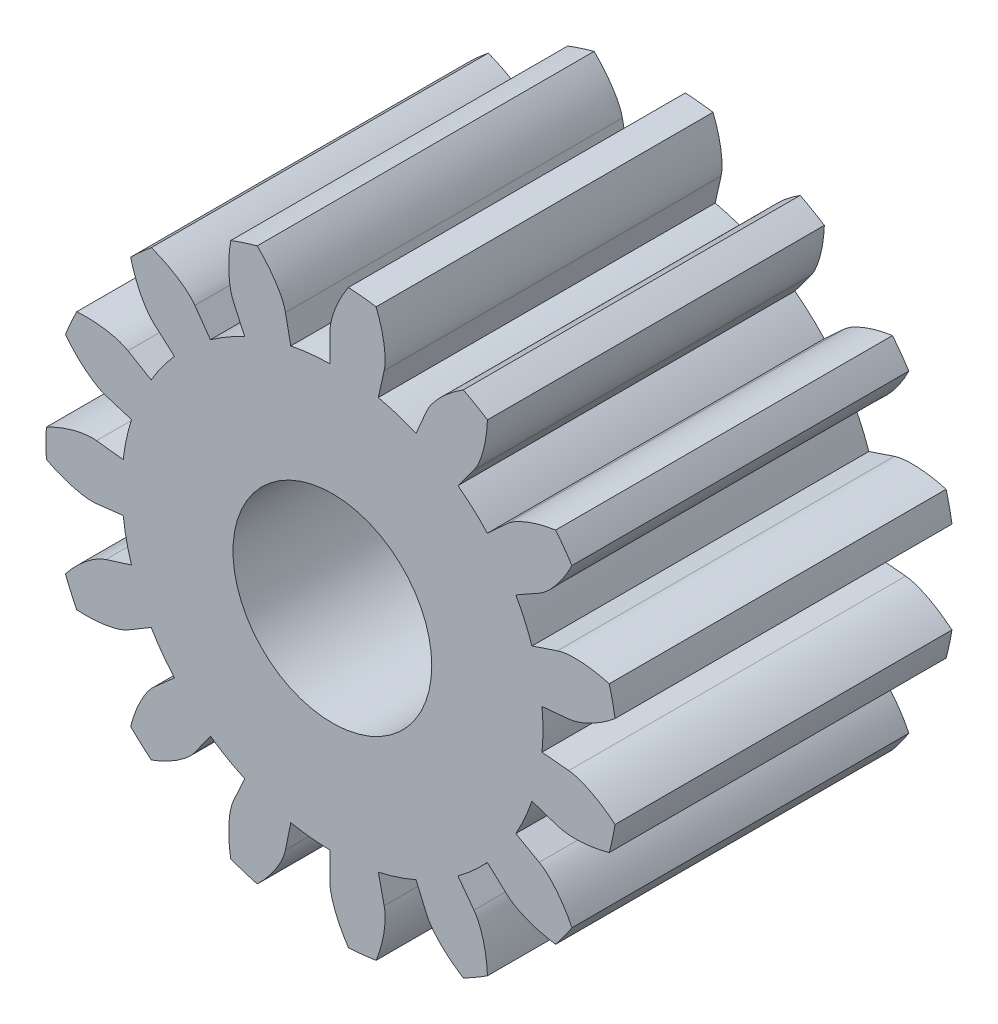
from build123d import *

# Parameters (mm, degrees)
SKETCH_1_R               = 4.25
SKETCH_1_R_2             = 1.475
EXTRUDE_1_DEPTH          = 5
CUT_EXTRUDE_1_DEPTH      = 8.818247886
PATTERN_CIRCULAR_1_COUNT = 15
PATTERN_CIRCULAR_1_ANGLE = 336


with BuildPart() as part:
    # 草图1 → 凸台-拉伸1 (new body)
    with BuildSketch(Plane.XY):
        Circle(SKETCH_1_R)
        Circle(SKETCH_1_R_2, mode=Mode.SUBTRACT)
    extrude(amount=EXTRUDE_1_DEPTH)

    # 草图1<3> → 切除-拉伸1 (cut, through all)
    with BuildSketch(Plane.XY):
        with BuildLine():
            Line((3.508222345, 0.331475445), (3.111143533, 0.293957334))
            ThreePointArc((3.111143533, 0.293957334), (3.121533961, 0.147141867), (3.125, 0))
            ThreePointArc((3.125, 0), (3.121533961, -0.147141867), (3.111143533, -0.293957334))
            Line((3.111143533, -0.293957334), (3.508222345, -0.331475445))
            add(Edge.make_bspline(
                [(3.508222345, -0.331475445), (3.534964575, -0.334002193), (3.609068191, -0.346611518), (3.745685977, -0.392607029), (3.920624729, -0.479806669), (4.060769078, -0.573573304), (4.155340497, -0.647322985), (4.195195075, -0.680322191)],
                knots=[0, 0, 0, 0, 0, 0.005604068, 0.015718248, 0.029959916, 0.040777449, 0.040777449, 0.040777449, 0.040777449, 0.040777449], degree=4))
            ThreePointArc((4.195195075, -0.680322191), (4.236276612, -0.341263045), (4.25, 0))
            ThreePointArc((4.25, 0), (4.236276612, 0.341263045), (4.195195075, 0.680322191))
            add(Edge.make_bspline(
                [(3.508222345, 0.331475445), (3.534964575, 0.334002193), (3.609068191, 0.346611518), (3.745685977, 0.392607029), (3.920624729, 0.479806669), (4.060769078, 0.573573304), (4.155340497, 0.647322985), (4.195195075, 0.680322191)],
                knots=[0, 0, 0, 0, 0, 0.005604068, 0.015718248, 0.029959916, 0.040777449, 0.040777449, 0.040777449, 0.040777449, 0.040777449], degree=4))
        make_face()
    cut_extrude_1 = extrude(amount=CUT_EXTRUDE_1_DEPTH, mode=Mode.SUBTRACT)

    # 阵列(圆周)1: 切除-拉伸1 ×15 about axis
    pattern_circular_1_axis = Axis((0, 0, 5), (0, 0, 1))
    for i in range(1, PATTERN_CIRCULAR_1_COUNT):
        add(cut_extrude_1.rotate(pattern_circular_1_axis, i * PATTERN_CIRCULAR_1_ANGLE / (PATTERN_CIRCULAR_1_COUNT - 1)), mode=Mode.SUBTRACT)


solid = part.part
